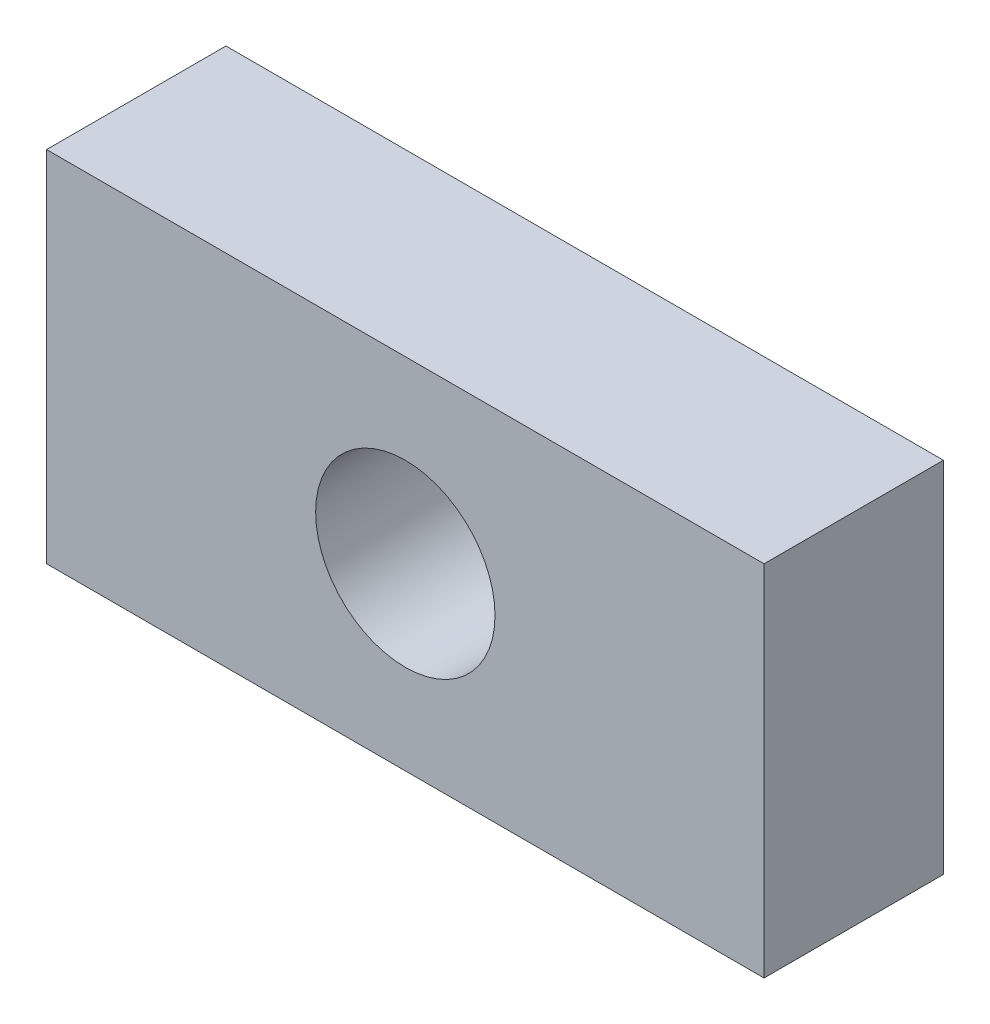
from build123d import *

# Parameters (mm, degrees)
SKETCH1_W           = 200
SKETCH1_H           = 100
BOSS_EXTRUDE1_DEPTH = 50
SKETCH1_3_R         = 25
CUT_EXTRUDE1_DEPTH  = 123.474487139


with BuildPart() as part:
    # Sketch1 → Boss-Extrude1 (new body)
    with BuildSketch(Plane.XY):
        Rectangle(SKETCH1_W, SKETCH1_H)
    extrude(amount=BOSS_EXTRUDE1_DEPTH)

    # Sketch1<3> → Cut-Extrude1 (cut, through all)
    with BuildSketch(Plane.XY):
        Circle(SKETCH1_3_R)
    extrude(amount=CUT_EXTRUDE1_DEPTH, mode=Mode.SUBTRACT)


solid = part.part
